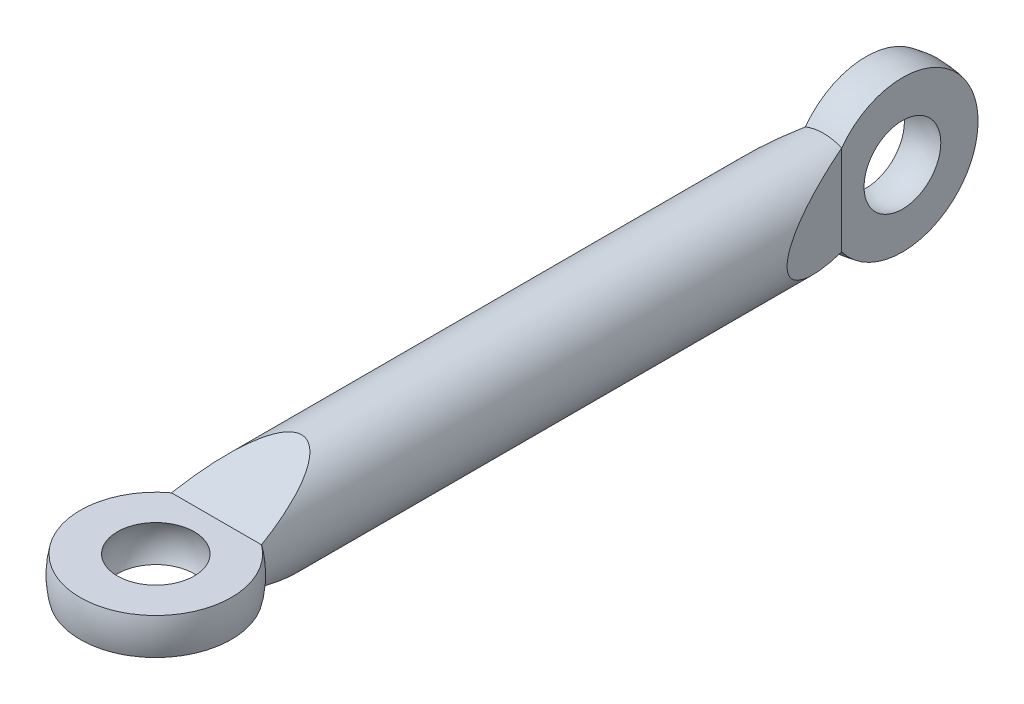
from build123d import *

# Parameters (mm, degrees)
SKETCH_1_R               = 4
EXTRUDE_1_DEPTH          = 25
CUT_EXTRUDE_1_DEPTH      = 38.512497308
CUT_EXTRUDE_1_DEPTH_BACK = 38.512497308
CUT_EXTRUDE_2_DEPTH      = 38.512497308
CUT_EXTRUDE_2_DEPTH_BACK = 38.512497308


with BuildPart() as part:
    # 草图1 → 凸台-拉伸1 (new, symmetric)
    with BuildSketch(Plane.XY):
        Circle(SKETCH_1_R)
    extrude(amount=EXTRUDE_1_DEPTH, both=True)

    # 草图2 → 旋转2 (revolve)
    with BuildSketch(Plane(origin=(0, 0, 0), x_dir=(1, 0, 0), z_dir=(0, 1, 0))):
        with BuildLine():
            ThreePointArc((0, 23.596875763), (6.403124237, 30), (0, 36.403124237))
            Line((0, 36.403124237), (0, 33.5))
            ThreePointArc((0, 33.5), (3.5, 30), (0, 26.5))
            Line((0, 26.5), (0, 23.596875763))
        make_face()
        with BuildLine():
            Line((0, -33.5), (0, -36.403124237))
            ThreePointArc((0, -36.403124237), (6.403124237, -30), (0, -23.596875763))
            Line((0, -23.596875763), (0, -26.5))
            ThreePointArc((0, -26.5), (3.5, -30), (0, -33.5))
        make_face()
    revolve(axis=Axis((0, 0, -36.403124237), (0, 0, 1)))

    # 草图3 → 切除-拉伸1 (cut, two sides: drawn at the far end of the back side and taken through both)
    with BuildSketch(Plane(origin=(0, 0, 0), x_dir=(0, 0, -1), z_dir=(1, 0, 0)).offset(-CUT_EXTRUDE_1_DEPTH_BACK)):
        Polygon((-18, 4), (-25, 1.5), (-38, 1.5), (-38, 8), (-18, 8), align=None)
        Polygon((-18, -8), (-18, -4), (-25, -1.5), (-38, -1.5), (-38, -8), align=None)
    extrude(amount=CUT_EXTRUDE_1_DEPTH + CUT_EXTRUDE_1_DEPTH_BACK, mode=Mode.SUBTRACT)

    # 草图4 → 切除-拉伸2 (cut, two sides: drawn at the far end of the back side and taken through both)
    with BuildSketch(Plane(origin=(0, 0, 0), x_dir=(1, 0, 0), z_dir=(0, 1, 0)).offset(-CUT_EXTRUDE_2_DEPTH_BACK)):
        Polygon((4, 18), (1.5, 25), (1.5, 39), (8, 39), (8, 18), align=None)
        Polygon((-8, 18), (-4, 18), (-1.5, 25), (-1.5, 39), (-8, 39), align=None)
    extrude(amount=CUT_EXTRUDE_2_DEPTH + CUT_EXTRUDE_2_DEPTH_BACK, mode=Mode.SUBTRACT)


solid = part.part
